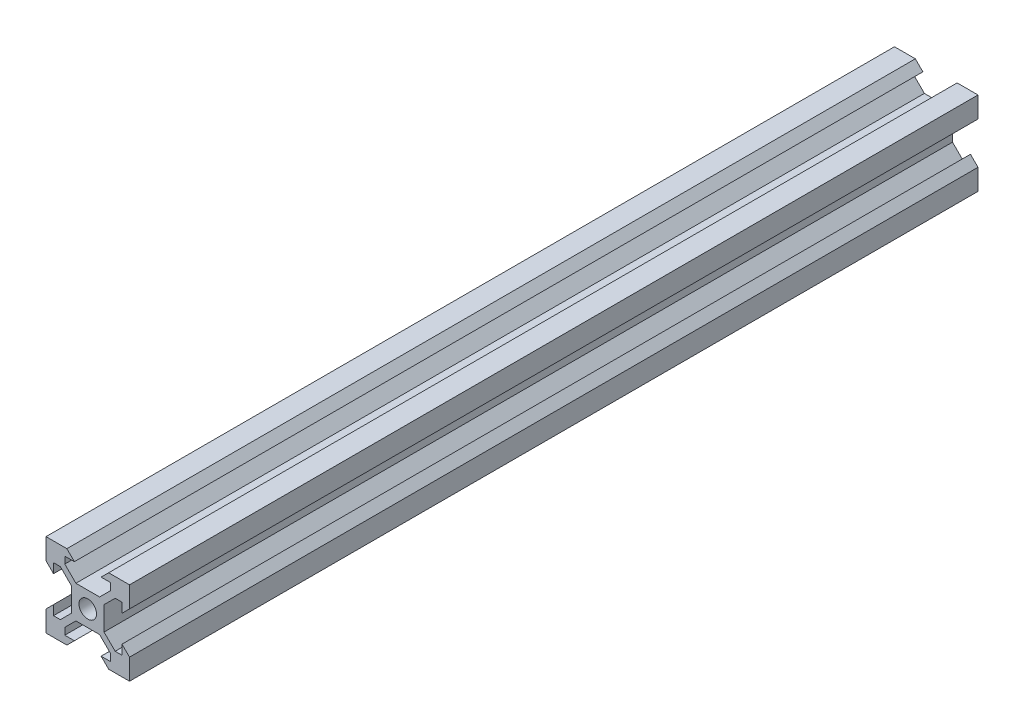
from build123d import *

# Parameters (mm, degrees)
SKETCH1_R           = 2.1
BOSS_EXTRUDE1_DEPTH = 101.6


with BuildPart() as part:
    # Sketch1 → Boss-Extrude1 (new, symmetric)
    with BuildSketch(Plane.XY):
        Polygon((-10, 10), (-5, 10), (-3.2, 8.2), (-5.499339828, 8.2), (-5.499339828, 6.56), (-2.84, 3.900660172), (2.84, 3.900660172), (5.499339828, 6.56), (5.499339828, 8.2), (3.2, 8.2), (5, 10), (10, 10), (10, 5), (8.2, 3.2), (8.2, 5.499339828), (6.56, 5.499339828), (3.900660172, 2.84), (3.900660172, -2.84), (6.56, -5.499339828), (8.2, -5.499339828), (8.2, -3.2), (10, -5), (10, -10), (5, -10), (3.2, -8.2), (5.499339828, -8.2), (5.499339828, -6.56), (2.84, -3.900660172), (-2.84, -3.900660172), (-5.499339828, -6.56), (-5.499339828, -8.2), (-3.2, -8.2), (-5, -10), (-10, -10), (-10, -5), (-8.2, -3.2), (-8.2, -5.499339828), (-6.56, -5.499339828), (-3.900660172, -2.84), (-3.900660172, 2.84), (-6.56, 5.499339828), (-8.2, 5.499339828), (-8.2, 3.2), (-10, 5), align=None)
        Circle(SKETCH1_R, mode=Mode.SUBTRACT)
    extrude(amount=BOSS_EXTRUDE1_DEPTH, both=True)


solid = part.part
